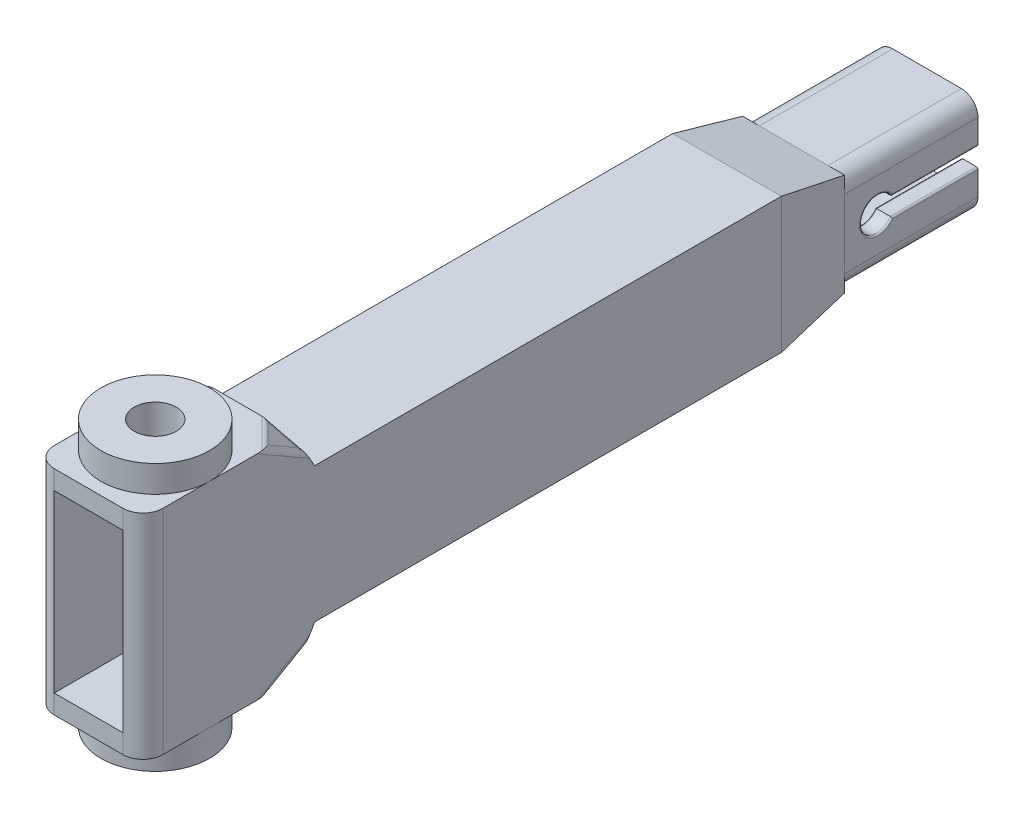
from build123d import *
from OCP.BRepFilletAPI import BRepFilletAPI_MakeChamfer

# Parameters (mm, degrees)
SKETCH_1_W          = 16.3
SKETCH_1_H          = 20.3
SKETCH_1_W_2        = 10.3
SKETCH_1_H_2        = 10.3
EXTRUDE_1_DEPTH     = 100
SKETCH_2_W          = 16.3
SKETCH_2_H          = 20.3
SKETCH_2_W_2        = 15.3
SKETCH_2_H_2        = 15.3
CUT_EXTRUDE_1_DEPTH = 20
CHAMFER_1_SIZE      = 2.5
CHAMFER_1_SIZE_2    = 10
CUT_EXTRUDE_2_REACH = 103.748
FILLET_1_R          = 0.25
FILLET_2_R          = 2.5
EXTRUDE_2_REACH     = 103.827
EXTRUDE_3_DEPTH     = 3
EXTRUDE_START       = -16.3
EXTRUDE_4_DEPTH     = 3
SKETCH_5_R          = 3.15
CUT_EXTRUDE_3_DEPTH = 133.323416217
SKETCH_6_W          = 16.3
SKETCH_6_H          = 30
SKETCH_6_R          = 3.15
CUT_EXTRUDE_4_DEPTH = 0.15
CUT_EXTRUDE_START   = -40.15
SKETCH_6_2_W        = 16.3
SKETCH_6_2_H        = 10
SKETCH_6_2_H_2      = 20
SKETCH_6_2_R        = 3.15
CUT_EXTRUDE_5_DEPTH = 0.15
CHAMFER_2_SIZE      = 0.5
CHAMFER_2_SIZE_2    = 10
SKETCH_7_R          = 15
SKETCH_7_W          = 16.3
SKETCH_7_H          = 20.08660254
CUT_EXTRUDE_6_DEPTH = 4
SKETCH_8_W          = 10.3
SKETCH_8_H          = 21.501273041
SKETCH_8_R          = 3.15
EXTRUDE_5_DEPTH     = 2
EXTRUDE_START_2     = 28.3
SKETCH_8_2_W        = 10.3
SKETCH_8_2_H        = 1.501273041
SKETCH_8_2_H_2      = 20
SKETCH_8_2_R        = 3.15
EXTRUDE_6_DEPTH     = 2
FILLET_3_R          = 3
CHAMFER_START       = 29
CHAMFER_3_OUTLINE_W = 8
CHAMFER_3_OUTLINE_H = 9
CHAMFER_3_DEPTH     = 2.982339926
CHAMFER_START_2     = -31.982339926
CHAMFER_4_OUTLINE_W = 8
CHAMFER_4_OUTLINE_H = 9
CHAMFER_4_DEPTH     = 1.788854382
CHAMFER_5_OUTLINE_W = 8
CHAMFER_5_OUTLINE_H = 9
CHAMFER_5_DEPTH     = 2.982339926
CHAMFER_6_OUTLINE_W = 8
CHAMFER_6_OUTLINE_H = 9
CHAMFER_6_DEPTH     = 1.788854382
FILLET_4_R          = 1


with BuildPart() as part:
    # 草图1 → 凸台-拉伸1 (new body)
    with BuildSketch(Plane.XY):
        Rectangle(SKETCH_1_W, SKETCH_1_H)
        Rectangle(SKETCH_1_W_2, SKETCH_1_H_2, mode=Mode.SUBTRACT)
    extrude(amount=EXTRUDE_1_DEPTH)

    # 草图2 → 切除-拉伸1 (cut)
    with BuildSketch(Plane(origin=(0, 0, 0), x_dir=(-1, 0, 0), z_dir=(0, 0, -1))):
        Rectangle(SKETCH_2_W, SKETCH_2_H)
        Rectangle(SKETCH_2_W_2, SKETCH_2_H_2, mode=Mode.SUBTRACT)
    extrude(amount=-CUT_EXTRUDE_1_DEPTH, mode=Mode.SUBTRACT)

    # 倒角1
    chamfer_1_edges_1 = [part.edges().sort_by_distance(p)[0] for p in [
        (0, -10.15, 20),
    ]]
    chamfer_1_side_1 = [part.faces().sort_by_distance(p)[0] for p in [
        (0, -10.1, 20),
    ]]
    chamfer_1_edges_2 = [part.edges().sort_by_distance(p)[0] for p in [
        (0, 10.15, 20),
    ]]
    chamfer_1_side_2 = [part.faces().sort_by_distance(p)[0] for p in [
        (0, 10.15, 20.05),
    ]]
    chamfer_1 = BRepFilletAPI_MakeChamfer(part.part.solid().wrapped)
    for e in chamfer_1_edges_1:
        chamfer_1.Add(CHAMFER_1_SIZE - 0.0001, CHAMFER_1_SIZE_2 - 0.0001, e.wrapped, chamfer_1_side_1[0].wrapped)
    for e in chamfer_1_edges_2:
        chamfer_1.Add(CHAMFER_1_SIZE_2 - 0.0001, CHAMFER_1_SIZE - 0.0001, e.wrapped, chamfer_1_side_2[0].wrapped)
    add(Compound.cast(chamfer_1.Shape()), mode=Mode.REPLACE)  # a hair under: the kernel refuses the full size

    # 草图3 → 切除-拉伸2 (cut, up to next)
    with BuildSketch(Plane(origin=(7.65, 0, 0), x_dir=(0, 0, -1), z_dir=(1, 0, 0)), mode=Mode.PRIVATE) as cut_extrude_2_sk1:
        with BuildLine():
            Line((0, 1.375), (-12.912088364, 1.375))
            ThreePointArc((-12.912088364, 1.375), (-12.605237059, 0.717711958), (-12.5, 0))
            ThreePointArc((-12.5, 0), (-12.605237059, -0.717711958), (-12.912088364, -1.375))
            Line((-12.912088364, -1.375), (0, -1.375))
            Line((0, -1.375), (0, 1.375))
        make_face()
    cut_extrude_2_tool1 = extrude(cut_extrude_2_sk1.sketch, amount=-CUT_EXTRUDE_2_REACH, mode=Mode.PRIVATE) & part.part
    # 草图3 → 切除-拉伸2 (cut, up to next)
    with BuildSketch(Plane(origin=(7.65, 0, 0), x_dir=(0, 0, -1), z_dir=(1, 0, 0)), mode=Mode.PRIVATE) as cut_extrude_2_sk2:
        with BuildLine():
            Line((-15, -1.375), (-15, 1.375))
            Line((-15, 1.375), (-12.912088364, 1.375))
            ThreePointArc((-12.912088364, 1.375), (-17.5, 0), (-12.912088364, -1.375))
            Line((-12.912088364, -1.375), (-15, -1.375))
        make_face()
    cut_extrude_2_tool2 = extrude(cut_extrude_2_sk2.sketch, amount=-CUT_EXTRUDE_2_REACH, mode=Mode.PRIVATE) & part.part
    # 草图3 → 切除-拉伸2 (cut, up to next)
    with BuildSketch(Plane(origin=(7.65, 0, 0), x_dir=(0, 0, -1), z_dir=(1, 0, 0)), mode=Mode.PRIVATE) as cut_extrude_2_sk3:
        with BuildLine():
            Line((-12.912088364, 1.375), (-15, 1.375))
            Line((-15, 1.375), (-15, -1.375))
            Line((-15, -1.375), (-12.912088364, -1.375))
            ThreePointArc((-12.912088364, -1.375), (-12.605237059, -0.717711958), (-12.5, 0))
            ThreePointArc((-12.5, 0), (-12.605237059, 0.717711958), (-12.912088364, 1.375))
        make_face()
    cut_extrude_2_tool3 = extrude(cut_extrude_2_sk3.sketch, amount=-CUT_EXTRUDE_2_REACH, mode=Mode.PRIVATE) & part.part
    # 草图3 → 切除-拉伸2 (cut, up to next)
    with BuildSketch(Plane(origin=(7.65, 0, 0), x_dir=(0, 0, -1), z_dir=(1, 0, 0)), mode=Mode.PRIVATE) as cut_extrude_2_sk4:
        with BuildLine():
            Line((-15, -1.375), (-15, 1.375))
            Line((-15, 1.375), (-12.912088364, 1.375))
            ThreePointArc((-12.912088364, 1.375), (-17.5, 0), (-12.912088364, -1.375))
            Line((-12.912088364, -1.375), (-15, -1.375))
        make_face()
    cut_extrude_2_tool4 = extrude(cut_extrude_2_sk4.sketch, amount=-CUT_EXTRUDE_2_REACH, mode=Mode.PRIVATE) & part.part
    # 草图3 → 切除-拉伸2 (cut, up to next)
    with BuildSketch(Plane(origin=(7.65, 0, 0), x_dir=(0, 0, -1), z_dir=(1, 0, 0)), mode=Mode.PRIVATE) as cut_extrude_2_sk5:
        with BuildLine():
            Line((-12.912088364, 1.375), (-15, 1.375))
            Line((-15, 1.375), (-15, -1.375))
            Line((-15, -1.375), (-12.912088364, -1.375))
            ThreePointArc((-12.912088364, -1.375), (-12.605237059, -0.717711958), (-12.5, 0))
            ThreePointArc((-12.5, 0), (-12.605237059, 0.717711958), (-12.912088364, 1.375))
        make_face()
    cut_extrude_2_tool5 = extrude(cut_extrude_2_sk5.sketch, amount=-CUT_EXTRUDE_2_REACH, mode=Mode.PRIVATE) & part.part
    add(cut_extrude_2_tool1.solids().sort_by_distance((7.65, 0, 6.316826))[0], mode=Mode.SUBTRACT)
    add(cut_extrude_2_tool2.solids().sort_by_distance((7.65, 0, 15.588772))[0], mode=Mode.SUBTRACT)
    add(cut_extrude_2_tool3.solids().sort_by_distance((7.65, 0, 13.813143))[0], mode=Mode.SUBTRACT)
    add(cut_extrude_2_tool4.solids().sort_by_distance((7.65, 0, 15.588772))[0], mode=Mode.SUBTRACT)
    add(cut_extrude_2_tool5.solids().sort_by_distance((7.65, 0, 13.813143))[0], mode=Mode.SUBTRACT)

    # 圆角1
    fillet_1_edges = [part.edges().sort_by_distance(p)[0] for p in [
        (5.15, 0, 17.5),
        (7.65, 1.375, 6.456044182),
        (5.15, -1.375, 6.456044182),
        (7.65, 0, 17.5),
        (7.65, -1.375, 6.456044182),
        (5.15, 1.375, 6.456044182),
    ]]
    fillet(fillet_1_edges, radius=FILLET_1_R)

    # 圆角2
    fillet_2_edges = [part.edges().sort_by_distance(p)[0] for p in [
        (-7.65, 7.65, 10),
        (7.65, 7.65, 10),
        (7.65, -7.65, 10),
        (-7.65, -7.65, 10),
    ]]
    fillet(fillet_2_edges, radius=FILLET_2_R)

    # 凸台-拉伸2: up to this face of the body (flat: up to its plane)
    extrude_2_end = Plane(part.part.faces().sort_by_distance((-8.15, 0, 60.573246373))[0])
    # 草图4 → 凸台-拉伸2 (add, up to the picked face)
    with BuildSketch(Plane(origin=(8.15, 0, 0), x_dir=(0, 0, -1), z_dir=(1, 0, 0)), mode=Mode.PRIVATE) as extrude_2_sk1:
        Polygon((-100, 5.15), (-100, 10.15), (-105.773502692, 20.15), (-125.773502692, 20.15), (-125.773502692, 15.15), (-105.773502692, 15.15), align=None)
    extrude_2_tool1 = split(extrude(extrude_2_sk1.sketch, amount=-EXTRUDE_2_REACH, mode=Mode.PRIVATE), bisect_by=extrude_2_end, keep=Keep.BOTH, mode=Mode.PRIVATE)
    # 草图4 → 凸台-拉伸2 (add, up to the picked face)
    with BuildSketch(Plane(origin=(8.15, 0, 0), x_dir=(0, 0, -1), z_dir=(1, 0, 0)), mode=Mode.PRIVATE) as extrude_2_sk2:
        Polygon((-100, -10.15), (-100, -5.15), (-105.773502692, -15.15), (-125.773502692, -15.15), (-125.773502692, -20.15), (-105.773502692, -20.15), align=None)
    extrude_2_tool2 = split(extrude(extrude_2_sk2.sketch, amount=-EXTRUDE_2_REACH, mode=Mode.PRIVATE), bisect_by=extrude_2_end, keep=Keep.BOTH, mode=Mode.PRIVATE)
    add(extrude_2_tool1.solids().sort_by(Axis((8.15, 16.529954, 112.886751), (-1, 0, 0)))[0])
    add(extrude_2_tool2.solids().sort_by(Axis((8.15, -16.529954, 112.886751), (-1, 0, 0)))[0])

    # 草图4<3> → 凸台-拉伸3 (add)
    with BuildSketch(Plane(origin=(8.15, 0, 0), x_dir=(0, 0, -1), z_dir=(1, 0, 0))):
        Polygon((-100, -5.15), (-100, 5.15), (-105.773502692, 15.15), (-125.773502692, 15.15), (-125.773502692, -15.15), (-105.773502692, -15.15), align=None)
    extrude(amount=-EXTRUDE_3_DEPTH)

    # 草图4<4> → 凸台-拉伸4 (add)
    with BuildSketch(Plane(origin=(8.15, 0, 0), x_dir=(0, 0, -1), z_dir=(1, 0, 0)).offset(EXTRUDE_START)):
        Polygon((-100, -5.15), (-100, 5.15), (-105.773502692, 15.15), (-125.773502692, 15.15), (-125.773502692, -15.15), (-105.773502692, -15.15), align=None)
    extrude(amount=EXTRUDE_4_DEPTH)

    # 草图5 → 切除-拉伸3 (cut, through all)
    with BuildSketch(Plane(origin=(0, 20.15, 0), x_dir=(1, 0, 0), z_dir=(0, 1, 0))):
        with Locations(Location((0, -115.773502692, 0), (0, 0, 270))):
            Circle(SKETCH_5_R)
    extrude(amount=-CUT_EXTRUDE_3_DEPTH, mode=Mode.SUBTRACT)

    # 草图6 → 切除-拉伸4 (cut)
    with BuildSketch(Plane(origin=(0, 20.15, 0), x_dir=(1, 0, 0), z_dir=(0, 1, 0))):
        with Locations((0, -110.773502692)):
            Rectangle(SKETCH_6_W, SKETCH_6_H)
        with Locations(Location((0, -115.773502692, 0), (0, 0, 180))):
            Circle(SKETCH_6_R, mode=Mode.SUBTRACT)
    extrude(amount=-CUT_EXTRUDE_4_DEPTH, mode=Mode.SUBTRACT)

    # 草图6<2> → 切除-拉伸5 (cut)
    # profile 1 of 2: a face of its own
    with BuildSketch(Plane(origin=(0, 20.15, 0), x_dir=(1, 0, 0), z_dir=(0, 1, 0)).offset(CUT_EXTRUDE_START)):
        with Locations((0, -100.773502692)):
            Rectangle(SKETCH_6_2_W, SKETCH_6_2_H)
    # profile 2 of 2: a face of its own
    with BuildSketch(Plane(origin=(0, 20.15, 0), x_dir=(1, 0, 0), z_dir=(0, 1, 0)).offset(CUT_EXTRUDE_START)):
        with Locations((0, -115.773502692)):
            Rectangle(SKETCH_6_2_W, SKETCH_6_2_H_2)
        with Locations(Location((0, -115.773502692, 0), (0, 0, 180))):
            Circle(SKETCH_6_2_R, mode=Mode.SUBTRACT)
    extrude(amount=-CUT_EXTRUDE_5_DEPTH, mode=Mode.SUBTRACT)

    # 倒角2
    chamfer_2_edges_1 = [part.edges().sort_by_distance(p)[0] for p in [
        (-8.15, 0, 20),
    ]]
    chamfer_2_side_1 = [part.faces().sort_by_distance(p)[0] for p in [
        (-8.14, 0, 20),
    ]]
    chamfer_2_edges_2 = [part.edges().sort_by_distance(p)[0] for p in [
        (8.15, 0, 20),
    ]]
    chamfer_2_side_2 = [part.faces().sort_by_distance(p)[0] for p in [
        (8.15, 0, 20.01),
    ]]
    chamfer_2 = BRepFilletAPI_MakeChamfer(part.part.solid().wrapped)
    for e in chamfer_2_edges_1:
        chamfer_2.Add(CHAMFER_2_SIZE - 0.0001, CHAMFER_2_SIZE_2 - 0.0001, e.wrapped, chamfer_2_side_1[0].wrapped)
    for e in chamfer_2_edges_2:
        chamfer_2.Add(CHAMFER_2_SIZE_2 - 0.0001, CHAMFER_2_SIZE - 0.0001, e.wrapped, chamfer_2_side_2[0].wrapped)
    add(Compound.cast(chamfer_2.Shape()), mode=Mode.REPLACE)  # a hair under: the kernel refuses the full size

    # 草图7 → 切除-拉伸6 (cut)
    # profile 1 of 3: a face of its own
    with BuildSketch(Plane(origin=(0, 20, 0), x_dir=(1, 0, 0), z_dir=(0, 1, 0))):
        with Locations((0, -115.773502692)):
            Circle(SKETCH_7_R)
        with Locations((0, -115.730201422)):
            Rectangle(SKETCH_7_W, SKETCH_7_H, mode=Mode.SUBTRACT)
    # profile 2 of 3: a face of its own
    with BuildSketch(Plane(origin=(0, 20, 0), x_dir=(1, 0, 0), z_dir=(0, 1, 0))):
        with BuildLine():
            Line((8.15, -125.773502692), (8.15, -115.773502692))
            ThreePointArc((8.15, -115.773502692), (1.2e-08, -123.923502692), (-8.15, -115.773502716))
            Line((-8.15, -115.773502716), (-8.15, -125.773502692))
            Line((-8.15, -125.773502692), (8.15, -125.773502692))
        make_face()
    # profile 3 of 3: a face of its own
    with BuildSketch(Plane(origin=(0, 20, 0), x_dir=(1, 0, 0), z_dir=(0, 1, 0))):
        with BuildLine():
            ThreePointArc((-8.15, -115.773502716), (-1.2e-08, -107.623502692), (8.15, -115.773502692))
            Line((8.15, -115.773502692), (8.15, -105.686900152))
            Line((8.15, -105.686900152), (-8.15, -105.686900152))
            Line((-8.15, -105.686900152), (-8.15, -115.773502716))
        make_face()
    cut_extrude_6 = extrude(amount=-CUT_EXTRUDE_6_DEPTH, mode=Mode.SUBTRACT)

    # 镜向1: 切除-拉伸6 across plane
    add(cut_extrude_6.mirror(Plane.ZX), mode=Mode.SUBTRACT)

    # 草图8 → 凸台-拉伸5 (add)
    with BuildSketch(Plane.XZ.offset(-15.15)):
        with Locations((0, 115.022866171)):
            Rectangle(SKETCH_8_W, SKETCH_8_H)
        with Locations(Location((0, 115.773502692, 0), (0, 0, 180))):
            Circle(SKETCH_8_R, mode=Mode.SUBTRACT)
    extrude(amount=EXTRUDE_5_DEPTH)

    # 草图8<2> → 凸台-拉伸6 (add)
    # profile 1 of 2: a face of its own
    with BuildSketch(Plane.XZ.offset(-15.15).offset(EXTRUDE_START_2)):
        with Locations((0, 105.022866171)):
            Rectangle(SKETCH_8_2_W, SKETCH_8_2_H)
    # profile 2 of 2: a face of its own
    with BuildSketch(Plane.XZ.offset(-15.15).offset(EXTRUDE_START_2)):
        with Locations((0, 115.773502692)):
            Rectangle(SKETCH_8_2_W, SKETCH_8_2_H_2)
        with Locations(Location((0, 115.773502692, 0), (0, 0, 180))):
            Circle(SKETCH_8_2_R, mode=Mode.SUBTRACT)
    extrude(amount=EXTRUDE_6_DEPTH)

    # 圆角3
    fillet_3_edges = [part.edges().sort_by_distance(p)[0] for p in [
        (8.15, 0, 125.773502692),
        (-8.15, 0, 125.773502692),
    ]]
    fillet(fillet_3_edges, radius=FILLET_3_R - 0.0001)  # a hair under: the kernel refuses the full size

    # 倒角3: read off the stored shape, not the designer's step
    # 倒角3 outline → 倒角3 (cut)
    with BuildSketch(Plane(origin=(0, 0, 0), x_dir=(0.894427190999916, 0.387298334620742, -0.22360679774997855), z_dir=(0.447213595499958, -0.7745966692414838, 0.447213595499957)).offset(CHAMFER_START)):
        with Locations((-23, 97.5)):
            Rectangle(CHAMFER_3_OUTLINE_W, CHAMFER_3_OUTLINE_H)
    extrude(amount=CHAMFER_3_DEPTH, mode=Mode.SUBTRACT)

    # 倒角4: read off the stored shape, not the designer's step
    # 倒角4 outline → 倒角4 (cut)
    with BuildSketch(Plane(origin=(0, 0, 0), x_dir=(0.8944271909999162, -0.3872983346207414, 0.2236067977499782), z_dir=(0.44721359549995726, 0.7745966692414843, -0.4472135954999572)).offset(CHAMFER_START_2)):
        with Locations((23, -97.5)):
            Rectangle(CHAMFER_4_OUTLINE_W, CHAMFER_4_OUTLINE_H)
    extrude(amount=CHAMFER_4_DEPTH, mode=Mode.SUBTRACT)

    # 倒角5: read off the stored shape, not the designer's step
    # 倒角5 outline → 倒角5 (cut)
    with BuildSketch(Plane(origin=(0, 0, 0), x_dir=(0.8944271909999162, -0.3872983346207414, -0.2236067977499782), z_dir=(0.44721359549995726, 0.7745966692414843, 0.4472135954999572)).offset(CHAMFER_START)):
        with Locations((-23, -97.5)):
            Rectangle(CHAMFER_5_OUTLINE_W, CHAMFER_5_OUTLINE_H)
    extrude(amount=CHAMFER_5_DEPTH, mode=Mode.SUBTRACT)

    # 倒角6: read off the stored shape, not the designer's step
    # 倒角6 outline → 倒角6 (cut)
    with BuildSketch(Plane(origin=(0, 0, 0), x_dir=(0.8944271909999162, 0.3872983346207414, 0.2236067977499782), z_dir=(0.44721359549995726, -0.7745966692414843, -0.4472135954999572)).offset(CHAMFER_START_2)):
        with Locations((23, 97.5)):
            Rectangle(CHAMFER_6_OUTLINE_W, CHAMFER_6_OUTLINE_H)
    extrude(amount=CHAMFER_6_DEPTH, mode=Mode.SUBTRACT)

    # 圆角4
    fillet_4_edges = [part.edges().sort_by_distance(p)[0] for p in [
        (-8.15, 14.267949192, 104.377499075),
        (-6.15, 14.267949192, 102.377499075),
        (-6.15, 16, 105.377499075),
        (6.15, 16, 105.377499075),
        (6.15, 14.267949192, 102.377499075),
        (8.15, 14.267949192, 104.377499075),
        (-8.15, -14.267949192, 104.377499075),
        (-6.15, -14.267949192, 102.377499075),
        (-6.15, -16, 105.377499075),
        (6.15, -14.267949192, 102.377499075),
        (8.15, -14.267949192, 104.377499075),
        (6.15, -16, 105.377499075),
    ]]
    fillet(fillet_4_edges, radius=FILLET_4_R)


solid = part.part
